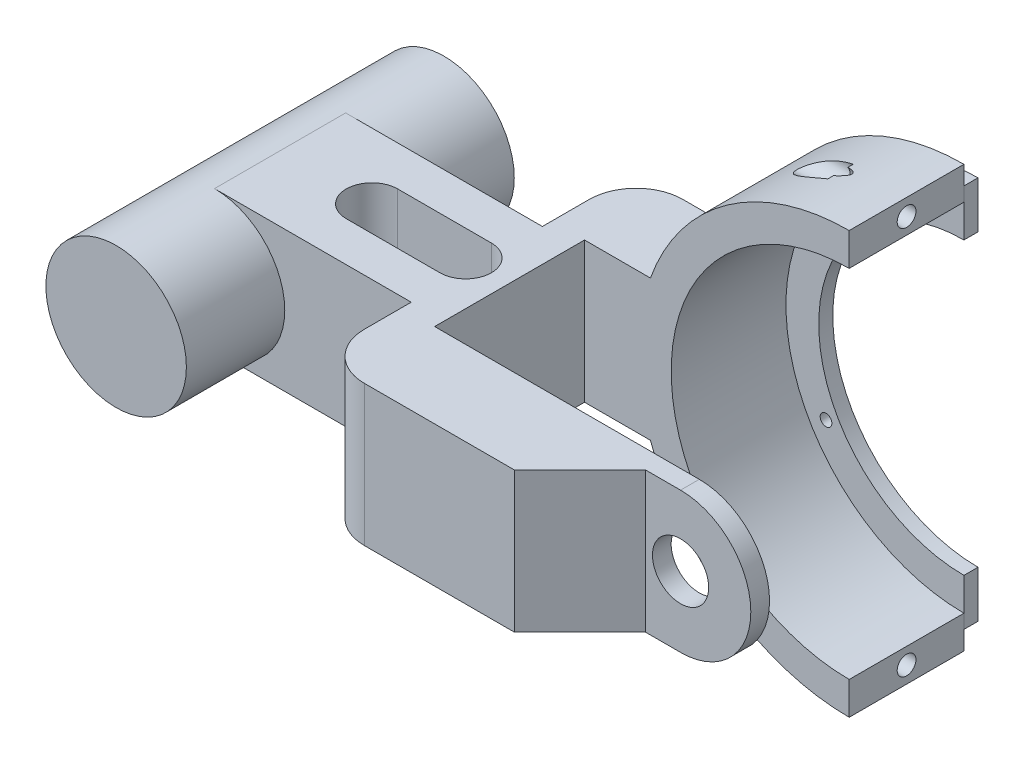
from build123d import *

# Parameters (mm, degrees)
BOSS_EXTRUDE1_DEPTH        = 30
FILLET1_R                  = 10
SKETCH4_R                  = 15
BOSS_EXTRUDE2_DEPTH        = 35
CUT_EXTRUDE1_DEPTH         = 70
SKETCH8_R                  = 6.000000000000003
CUT_EXTRUDE2_DEPTH         = 100
SKETCH9_W                  = 3.9999999999999982
SKETCH9_H                  = 30.000000000000004
BOSS_EXTRUDE3_DEPTH        = 10
CUT_EXTRUDE4_DEPTH         = 15
BOSS_EXTRUDE4_DEPTH        = 18
CUT_EXTRUDE8_START         = -18
CUT_EXTRUDE8_DEPTH         = 18
BOSS_EXTRUDE5_DEPTH        = 18
SKETCH18_R                 = 44.999999999999964
SKETCH18_R_2               = 37.99999999999997
BOSS_EXTRUDE6_DEPTH        = 6.5
SKETCH20_R                 = 41
SKETCH20_R_2               = 31
BOSS_EXTRUDE7_DEPTH        = 3
CUT_EXTRUDE15_START        = -27.5
CUT_EXTRUDE15_DEPTH        = 27.5
SKETCH27_R                 = 2.0000000000000036
CUT_EXTRUDE18_DEPTH        = 1000
CUT_EXTRUDE19_DEPTH        = 120.80681590516343
SKETCH29_R                 = 3.0000000000000018
CUT_EXTRUDE20_DEPTH        = 62
M3_TAPPED_HOLE1_AT_2_COUNT = 2
M3_TAPPED_HOLE1_AT_2_PITCH = 34.00000000000008


# Read off the part's stored shape, not the designer's step: Cut-Extrude15
with BuildPart() as part:
    # Sketch1 → Boss-Extrude1 (new body)
    with BuildSketch(Plane(origin=(0, 0, 0), x_dir=(1, 0, 0), z_dir=(0, 1, 0))):
        Polygon((-29.403832198091994, 20.049584631360354), (-29.403832198091994, -7.950415368639647), (12.596167801908011, -7.9504153686396455), (12.596167801908013, -27.950415368639646), (83.59616780190801, -27.950415368639643), (83.59616780190801, -9.950415368639646), (19.596167801908006, -9.950415368639622), (19.596167801908013, 22.049584631360172), (83.596167801908, 22.049584631360354), (83.596167801908, 40.049584631360354), (12.596167801908003, 40.049584631360354), (12.596167801908011, 20.04958463136035), align=None)
    extrude(amount=BOSS_EXTRUDE1_DEPTH)

    # Fillet1
    fillet1_edges = [part.edges().sort_by_distance(p)[0] for p in [
        (12.596167801908003, 15, -40.049584631360354),
        (12.596167801908013, 15, 27.950415368639646),
    ]]
    fillet(fillet1_edges, radius=FILLET1_R)

    # Sketch4 → Boss-Extrude2 (add, symmetric)
    with BuildSketch(Plane.XY.offset(-6.049584631360346)):
        with Locations((-29.403832198091994, 15)):
            Circle(SKETCH4_R)
    extrude(amount=BOSS_EXTRUDE2_DEPTH, both=True)

    # Sketch5 → Cut-Extrude1 (cut)
    with BuildSketch(Plane(origin=(0, 30, 0), x_dir=(1, 0, 0), z_dir=(0, 1, 0))):
        Polygon((54.59616780190807, -27.950415368639646), (68.59616780190801, -13.950415368639645), (83.59616780190801, -13.950415368639646), (83.59616780190801, -27.950415368639643), align=None)
    extrude(amount=-CUT_EXTRUDE1_DEPTH, mode=Mode.SUBTRACT)

    # Sketch8 → Cut-Extrude2 (cut)
    with BuildSketch(Plane.XY.offset(13.950415368639636)):
        with Locations((76.09616780190801, 14.999999999999998)):
            Circle(SKETCH8_R)
    extrude(amount=-CUT_EXTRUDE2_DEPTH, mode=Mode.SUBTRACT)

    # Sketch9 → Boss-Extrude3 (add)
    with BuildSketch(Plane(origin=(83.59616780190801, 0, 0), x_dir=(0, 0, -1), z_dir=(1, 0, 0))):
        with Locations((-11.950415368639668, 15.000000000000002)):
            Rectangle(SKETCH9_W, SKETCH9_H)
    extrude(amount=BOSS_EXTRUDE3_DEPTH)

    # Sketch14 → Cut-Extrude4 (cut)
    with BuildSketch(Plane.XY.offset(13.950415368639636)):
        with BuildLine():
            Line((76.09616780190801, 30), (93.59616780190801, 30))
            Line((93.59616780190801, 30), (93.59616780190801, 0))
            Line((93.59616780190801, 0), (76.09616780190801, 0))
            ThreePointArc((76.09616780190801, 0), (91.09616780190801, 14.999999999999998), (76.09616780190801, 30))
        make_face()
    extrude(amount=-CUT_EXTRUDE4_DEPTH, mode=Mode.SUBTRACT)

    # Sketch13 → Boss-Extrude4 (add)
    with BuildSketch(Plane(origin=(0, 0, -40.049584631360354), x_dir=(-1, 0, -2.3e-16), z_dir=(2.3e-16, 0, -1))):
        with BuildLine():
            Line((-76.09616780190801, -29.999999999999993), (-76.09616780190802, 59.99999999999999))
            ThreePointArc((-76.09616780190802, 59.99999999999999), (-31.096167801908017, 15.000000000000009), (-76.09616780190801, -29.999999999999993))
        make_face()
    extrude(amount=-BOSS_EXTRUDE4_DEPTH)

    # Sketch16 → Cut-Extrude8 (cut)
    with BuildSketch(Plane(origin=(0, 0, -40.049584631360354), x_dir=(-1, 0, -7.8e-16), z_dir=(7.8e-16, 0, -1)).offset(CUT_EXTRUDE8_START)):
        with BuildLine():
            ThreePointArc((-76.09616780190801, -23), (-38.09616780190802, 15.000000000000009), (-76.09616780190804, 52.999999999999986))
            Line((-76.09616780190804, 52.99999999999999), (-76.09616780190802, 30))
            ThreePointArc((-76.09616780190802, 30.000000000000004), (-61.09616780190801, 15.000000000000012), (-76.09616780190801, 3.55e-15))
            Line((-76.09616780190802, 0), (-76.09616780190801, -22.999999999999993))
        make_face()
        with BuildLine():
            Line((-76.09616780190802, 20.999999999999996), (-76.09616780190802, 30))
            Line((-76.09616780190802, 30), (-83.596167801908, 30))
            Line((-83.596167801908, 30), (-83.596167801908, 0))
            Line((-83.596167801908, 0), (-76.09616780190801, -6.94e-15))
            Line((-76.09616780190802, 0), (-76.09616780190802, 8.999999999999993))
            ThreePointArc((-76.09616780190801, 8.999999999999996), (-82.09616780190801, 14.999999999999996), (-76.09616780190801, 20.999999999999996))
        make_face()
        with BuildLine():
            ThreePointArc((-76.09616780190801, 3.55e-15), (-61.09616780190801, 15.000000000000012), (-76.09616780190802, 30.000000000000004))
            Line((-76.09616780190802, 30), (-76.09616780190802, 20.999999999999996))
            Line((-76.09616780190802, 20.999999999999996), (-76.09616780190802, 8.999999999999993))
            Line((-76.09616780190802, 8.999999999999993), (-76.09616780190802, 0))
        make_face()
    extrude(amount=CUT_EXTRUDE8_DEPTH, mode=Mode.SUBTRACT)

    # Sketch17 → Boss-Extrude5 (add)
    with BuildSketch(Plane(origin=(0, 0, -40.049584631360354), x_dir=(-1, 0, -7.8e-16), z_dir=(7.8e-16, 0, -1))):
        with BuildLine():
            Line((-76.09616780190802, 59.99999999999999), (-76.09616780190804, 52.99999999999998))
            ThreePointArc((-76.09616780190804, 52.99999999999998), (-113.88848540609249, 11.032541102361632), (-68.20461692079768, -22.17154052081842))
            Line((-68.20461692079768, -22.17154052081842), (-68.20461692079766, -29.302634511853192))
            ThreePointArc((-68.20461692079766, -29.302634511853192), (-120.92148739381611, 11.038848212539316), (-76.09616780190802, 59.99999999999999))
        make_face()
    extrude(amount=-BOSS_EXTRUDE5_DEPTH)

    # Sketch18 → Boss-Extrude6 (add)
    with BuildSketch(Plane(origin=(0, 0, -40.049584631360354), x_dir=(-1, 0, -7.8e-16), z_dir=(7.8e-16, 0, -1))):
        with Locations((-76.09616780190805, 14.999999999999998)):
            Circle(SKETCH18_R)
        with Locations((-76.09616780190805, 14.999999999999998)):
            Circle(SKETCH18_R_2, mode=Mode.SUBTRACT)
    extrude(amount=BOSS_EXTRUDE6_DEPTH)


with BuildPart() as body_2:
    # Sketch20 → Boss-Extrude7 (new body)
    with BuildSketch(Plane(origin=(3.639e-14, 0, -46.549584631360354), x_dir=(-1, 0, -7.8e-16), z_dir=(7.8e-16, 0, -1))):
        with Locations((-76.09616780190802, 14.999999999999998)):
            Circle(SKETCH20_R)
        with Locations((-76.09616780190802, 14.999999999999998)):
            Circle(SKETCH20_R_2, mode=Mode.SUBTRACT)
    extrude(amount=BOSS_EXTRUDE7_DEPTH)


with BuildPart() as cut_extrude15_tool:
    # Cut-Extrude15 outline → Cut-Extrude15 (new body)
    with BuildSketch(Plane(origin=(3.874e-14, 0, -49.549584631360354), x_dir=(-1, 0, -7.8e-16), z_dir=(7.8e-16, 0, -1)).offset(CUT_EXTRUDE15_START)):
        with BuildLine():
            ThreePointArc((-76.096167802, -16), (-107.096167802, 15), (-76.096167802, 46))
            Line((-76.096167802, 46), (-76.096167802, 60))
            ThreePointArc((-76.096167802, 60), (-121.096167802, 15), (-76.096167802, -30))
            Line((-76.096167802, -30), (-76.096167802, -16))
        make_face()
    extrude(amount=CUT_EXTRUDE15_DEPTH)


with BuildPart() as part_1:
    add(part.part)

    # Cut-Extrude15: cut by cut_extrude15_tool
    add(cut_extrude15_tool.part, mode=Mode.SUBTRACT)

    # Sketch27 → Cut-Extrude18 (cut)
    with BuildSketch(Plane(origin=(0, 0, 0), x_dir=(0, 0, -1), z_dir=(1, 0, 0))):
        with Locations(Location((34.29958463136034, 56.45704467353929, 0), (0, 0, 180))):
            Circle(SKETCH27_R)
        with Locations(Location((34.29958463136034, -26.457044673539237, 0), (0, 0, 180))):
            Circle(SKETCH27_R)
    extrude(amount=CUT_EXTRUDE18_DEPTH, mode=Mode.SUBTRACT)

    # Sketch28 → Cut-Extrude19 (cut, through all)
    with BuildSketch(Plane(origin=(0, 30, 0), x_dir=(1, 0, 0), z_dir=(0, 1, 0))):
        with BuildLine():
            Line((-9.783074876156928, 11.549584631360354), (10.216925123843072, 11.549584631360354))
            ThreePointArc((10.216925123843072, 11.549584631360354), (15.716925123843072, 6.0495846313603545), (10.216925123843072, 0.5495846313603534))
            Line((10.216925123843072, 0.5495846313603534), (-9.783074876156928, 0.5495846313603552))
            ThreePointArc((-9.783074876156928, 0.5495846313603552), (-15.28307487615696, 6.0495846313603225), (-9.783074876156928, 11.549584631360354))
        make_face()
    extrude(amount=-CUT_EXTRUDE19_DEPTH, mode=Mode.SUBTRACT)

    # Sketch29 → Cut-Extrude20 (cut)
    with BuildSketch(Plane(origin=(0, 0, 0), x_dir=(0, 0, -1), z_dir=(1, 0, 0))):
        with Locations((34.29958463136034, 56.45704467353929)):
            Circle(SKETCH29_R)
        with Locations((34.29958463136034, -26.457044673539237)):
            Circle(SKETCH29_R)
    extrude(amount=CUT_EXTRUDE20_DEPTH, mode=Mode.SUBTRACT)


with BuildPart() as body_2_1:
    add(body_2.part)

    # Cut-Extrude15: cut by cut_extrude15_tool
    add(cut_extrude15_tool.part, mode=Mode.SUBTRACT)

    # Sketch31 → M3 Tapped Hole1 (revolve, cut)
    with BuildSketch(Plane(origin=(46.65130407323663, 32.00000000000077, -49.54958463136032), x_dir=(0, 1, 0), z_dir=(1, 0, 7.8e-16))):
        Polygon((0, 0), (-1.923e-14, 78.50000000000006), (1.2499999999999898, 78.50000000000006), (1.2499999999999871, -1.4e-15), align=None)
    m3_tapped_hole1 = revolve(axis=Axis((46.65130407323664, 32.00000000000077, -55.89958463136031), (-8.1e-16, 0, 1)), mode=Mode.SUBTRACT)

    # M3 Tapped Hole1 at 2: M3 Tapped Hole1 ×2
    with Locations(*[(0, -i * M3_TAPPED_HOLE1_AT_2_PITCH, 0) for i in range(1, M3_TAPPED_HOLE1_AT_2_COUNT)]):
        add(m3_tapped_hole1, mode=Mode.SUBTRACT)


solid = Compound([part_1.part, body_2_1.part])
